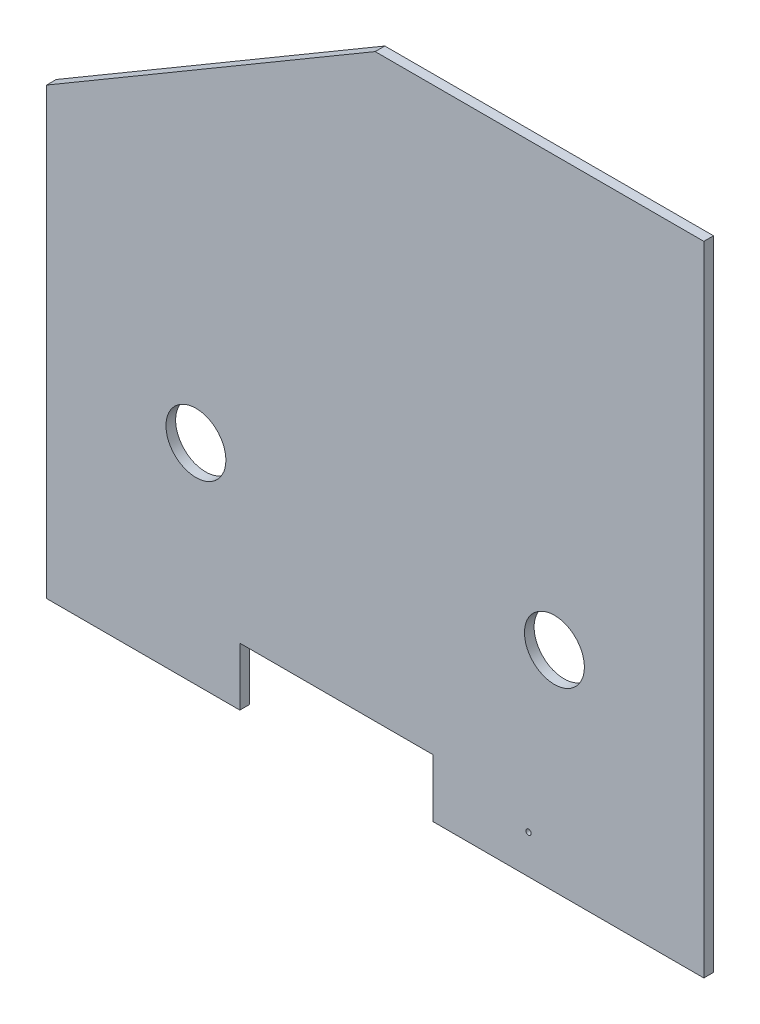
from build123d import *

# Parameters (mm, degrees)
FRAME_EXTERIOR_MASTER_OUTLINE_R = 19.685
FRAME_EXTERIOR_MASTER_DEPTH     = 6.35
SKETCH1_R                       = 1.75
CUT_EXTRUDE1_DEPTH              = 611.690430988


# Read off the part's stored shape, not the designer's step: Frame Exterior Master
with BuildPart() as part:
    # Frame Exterior Master outline → Frame Exterior Master (new body)
    with BuildSketch(Plane.XY):
        Polygon((431.8, 12.7), (431.8, 431.8), (215.9, 431.8), (0, 304.8), (0, 12.7), (127, 12.7), (127, 50.8), (254, 50.8), (254, 12.7), align=None)
        with Locations((98.15, 150.3)):
            Circle(FRAME_EXTERIOR_MASTER_OUTLINE_R, mode=Mode.SUBTRACT)
        with Locations((333.65, 150.3)):
            Circle(FRAME_EXTERIOR_MASTER_OUTLINE_R, mode=Mode.SUBTRACT)
    extrude(amount=FRAME_EXTERIOR_MASTER_DEPTH)

    # Sketch1 → Cut-Extrude1 (cut, through all)
    with BuildSketch(Plane.XY.offset(6.35)):
        with Locations((316.667678943, 38.1)):
            Circle(SKETCH1_R)
    extrude(amount=-CUT_EXTRUDE1_DEPTH, mode=Mode.SUBTRACT)


solid = part.part
